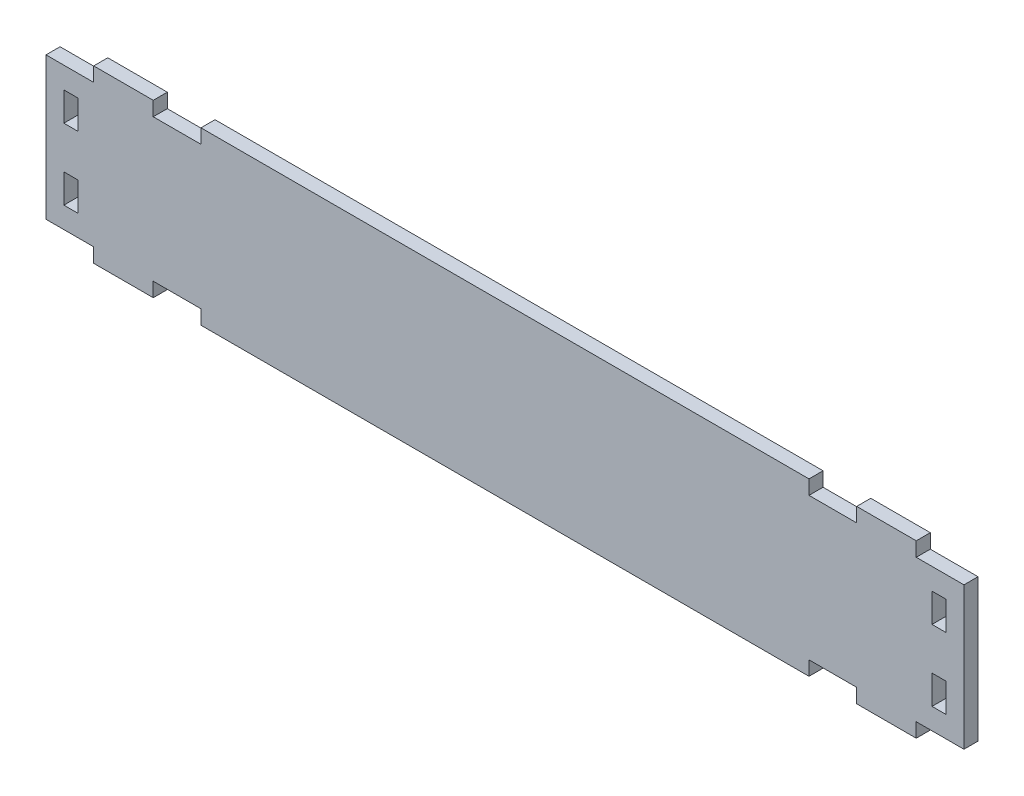
from build123d import *

# Parameters (mm, degrees)
SKETCH1_W           = 326.39
SKETCH1_H           = 60.799999812
BOSS_EXTRUDE1_DEPTH = 5
SKETCH9_W           = 16.959219297
SKETCH9_H           = 5.08
CUT_EXTRUDE2_DEPTH  = 5.08
CUT_EXTRUDE3_REACH  = 333.163
SKETCH11_W          = 5
SKETCH11_H          = 10.254787301


with BuildPart() as part:
    # Sketch1 → Boss-Extrude1 (new body)
    with BuildSketch(Plane.XY):
        with Locations((-163.195, 25.4)):
            Rectangle(SKETCH1_W, SKETCH1_H)
    extrude(amount=BOSS_EXTRUDE1_DEPTH)

    # Sketch9 → Cut-Extrude2 (cut)
    with BuildSketch(Plane.XY.offset(4.999999906)):
        with Locations((-46.614250443, -2.459999906)):
            Rectangle(SKETCH9_W, SKETCH9_H)
        with Locations((-8.479609649, -2.459999906)):
            Rectangle(SKETCH9_W, SKETCH9_H)
        with Locations((-8.479609649, 53.259999906)):
            Rectangle(SKETCH9_W, SKETCH9_H)
        with Locations((-46.614250443, 53.259999906)):
            Rectangle(SKETCH9_W, SKETCH9_H)
        with Locations((-279.775749558, 53.259999906)):
            Rectangle(SKETCH9_W, SKETCH9_H)
        with Locations((-317.910390352, 53.259999906)):
            Rectangle(SKETCH9_W, SKETCH9_H)
        with Locations((-317.910390352, -2.459999906)):
            Rectangle(SKETCH9_W, SKETCH9_H)
        with Locations((-279.775749558, -2.459999906)):
            Rectangle(SKETCH9_W, SKETCH9_H)
    extrude(amount=-CUT_EXTRUDE2_DEPTH, mode=Mode.SUBTRACT)

    # Sketch11 → Cut-Extrude3 (cut, up to next)
    with BuildSketch(Plane(origin=(0, 0, 0), x_dir=(-1, 0, 0), z_dir=(0, 0, -1)), mode=Mode.PRIVATE) as cut_extrude3_sk1:
        with Locations((8.85, 37.976893645)):
            Rectangle(SKETCH11_W, SKETCH11_H)
    cut_extrude3_tool1 = extrude(cut_extrude3_sk1.sketch, amount=-CUT_EXTRUDE3_REACH, mode=Mode.PRIVATE) & part.part
    # Sketch11 → Cut-Extrude3 (cut, up to next)
    with BuildSketch(Plane(origin=(0, 0, 0), x_dir=(-1, 0, 0), z_dir=(0, 0, -1)), mode=Mode.PRIVATE) as cut_extrude3_sk2:
        with Locations((8.85, 12.743106261)):
            Rectangle(SKETCH11_W, SKETCH11_H)
    cut_extrude3_tool2 = extrude(cut_extrude3_sk2.sketch, amount=-CUT_EXTRUDE3_REACH, mode=Mode.PRIVATE) & part.part
    # Sketch11 → Cut-Extrude3 (cut, up to next)
    with BuildSketch(Plane(origin=(0, 0, 0), x_dir=(-1, 0, 0), z_dir=(0, 0, -1)), mode=Mode.PRIVATE) as cut_extrude3_sk3:
        with Locations((317.54, 12.743106261)):
            Rectangle(SKETCH11_W, SKETCH11_H)
    cut_extrude3_tool3 = extrude(cut_extrude3_sk3.sketch, amount=-CUT_EXTRUDE3_REACH, mode=Mode.PRIVATE) & part.part
    # Sketch11 → Cut-Extrude3 (cut, up to next)
    with BuildSketch(Plane(origin=(0, 0, 0), x_dir=(-1, 0, 0), z_dir=(0, 0, -1)), mode=Mode.PRIVATE) as cut_extrude3_sk4:
        with Locations((317.54, 37.976893645)):
            Rectangle(SKETCH11_W, SKETCH11_H)
    cut_extrude3_tool4 = extrude(cut_extrude3_sk4.sketch, amount=-CUT_EXTRUDE3_REACH, mode=Mode.PRIVATE) & part.part
    add(cut_extrude3_tool1.solids().sort_by_distance((-8.85, 37.976894, 0))[0], mode=Mode.SUBTRACT)
    add(cut_extrude3_tool2.solids().sort_by_distance((-8.85, 12.743106, 0))[0], mode=Mode.SUBTRACT)
    add(cut_extrude3_tool3.solids().sort_by_distance((-317.54, 12.743106, 0))[0], mode=Mode.SUBTRACT)
    add(cut_extrude3_tool4.solids().sort_by_distance((-317.54, 37.976894, 0))[0], mode=Mode.SUBTRACT)


solid = part.part
